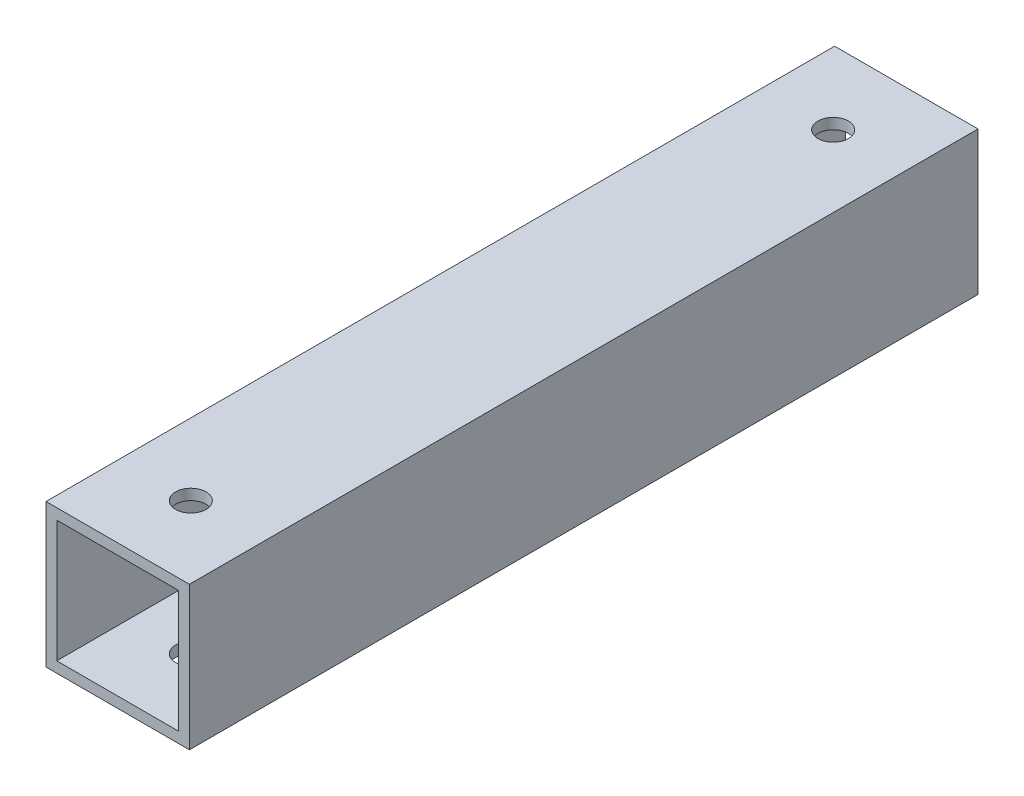
from build123d import *

# Parameters (mm, degrees)
SKETCH1_W           = 20
SKETCH1_H           = 20
SKETCH1_W_2         = 17
SKETCH1_H_2         = 17
BOSS_EXTRUDE1_DEPTH = 110
SKETCH2_R           = 2.125
CUT_EXTRUDE1_DEPTH  = 113.249721603


with BuildPart() as part:
    # Sketch1 → Boss-Extrude1 (new body)
    with BuildSketch(Plane.XY):
        Rectangle(SKETCH1_W, SKETCH1_H)
        Rectangle(SKETCH1_W_2, SKETCH1_H_2, mode=Mode.SUBTRACT)
    extrude(amount=-BOSS_EXTRUDE1_DEPTH)

    # Sketch2 → Cut-Extrude1 (cut, through all)
    with BuildSketch(Plane(origin=(0, 10, 0), x_dir=(1, 0, 0), z_dir=(0, 1, 0))):
        with Locations((0, 10.2)):
            Circle(SKETCH2_R)
        with Locations((0, 99.8)):
            Circle(SKETCH2_R)
    extrude(amount=-CUT_EXTRUDE1_DEPTH, mode=Mode.SUBTRACT)


solid = part.part
